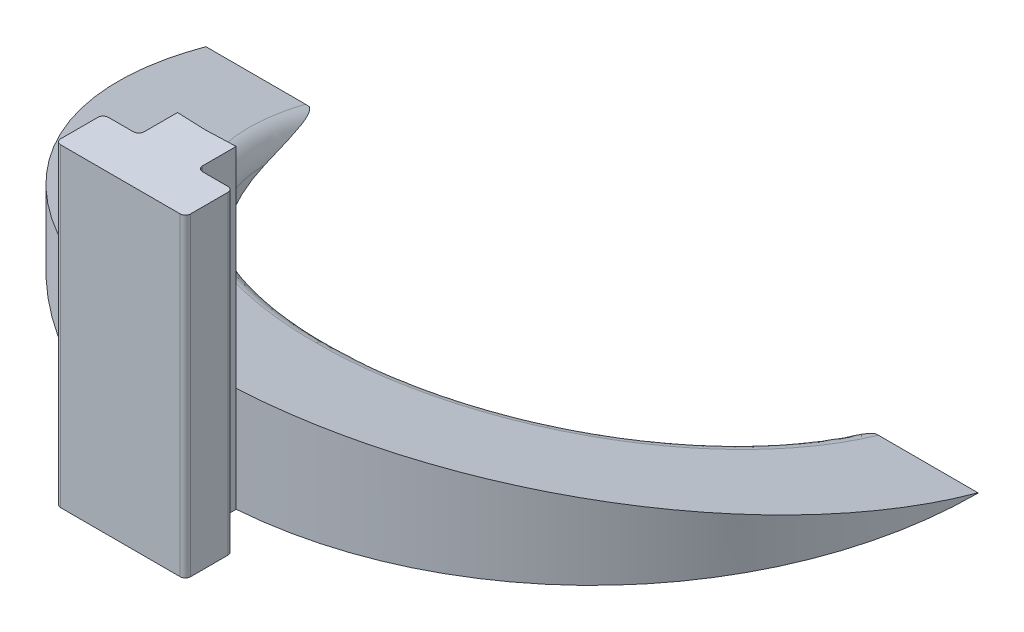
from build123d import *

# Parameters (mm, degrees)
BOSS_EXTRUDE1_DEPTH      = 10
BOSS_EXTRUDE2_DEPTH      = 20
BOSS_EXTRUDE2_DEPTH_BACK = 10
CUT_EXTRUDE1_DEPTH       = 90
FILLET1_R                = 2
FILLET3_R                = 0.5


with BuildPart() as part:
    # Sketch1 → Boss-Extrude1 (new body)
    with BuildSketch(Plane(origin=(0, 0, 0), x_dir=(1, 0, 0), z_dir=(0, 1, 0))):
        with BuildLine():
            Line((36.892843318, -6.916769299), (25.392844844, -6.907371064))
            ThreePointArc((25.392844844, -6.907371064), (17.862146893, -24.595305322), (0.029881046, -31.777555993))
            ThreePointArc((0.029881046, -31.777555993), (-17.799721033, -24.588695191), (-25.323861346, -6.897970432))
            Line((-25.323861346, -6.897970432), (-36.823861346, -6.897970432))
            ThreePointArc((-36.823861346, -6.897970432), (0.025091553, -43.765722197), (36.892843318, -6.916769299))
        make_face()
    extrude(amount=BOSS_EXTRUDE1_DEPTH)

    # Sketch2 → Boss-Extrude2 (add, two sides: drawn at the far end of the back side and taken through both)
    with BuildSketch(Plane(origin=(0, 10, 0), x_dir=(1, 0, 0), z_dir=(0, 1, 0)).offset(-BOSS_EXTRUDE2_DEPTH_BACK)):
        Polygon((2.825670187, -43.65988738), (2.825670187, -47.35988738), (6.225670187, -47.35988738), (6.225670187, -51.90988738), (-6.18199259, -51.90493029), (-6.178356973, -47.354931742), (-2.778358058, -47.357648467), (-2.775401622, -43.657649648), (0.025091553, -43.765722197), align=None)
    extrude(amount=BOSS_EXTRUDE2_DEPTH + BOSS_EXTRUDE2_DEPTH_BACK)

    # Sketch5 → Cut-Extrude1 (cut)
    with BuildSketch(Plane(origin=(36.898477146, 0, 0.030154834), x_dir=(0.0008172376243904341, 0, -0.9999996660612769), z_dir=(0.999999666061277, 0, 0.0008172376243904342))):
        Polygon((-6.7817199, 0), (-6.886616769, 10), (-43.660796033, 10), align=None)
    extrude(amount=-CUT_EXTRUDE1_DEPTH, mode=Mode.SUBTRACT)

    # Fillet1
    fillet1_edges = [part.edges().sort_by_distance(p)[0] for p in [
        (18.020480229, 4.783799393, 24.438665278),
        (-17.957999216, 4.789963113, 24.431993538),
    ]]
    fillet(fillet1_edges, radius=FILLET1_R)

    # Fillet3
    fillet3_edges = [part.edges().sort_by_distance(p)[0] for p in [
        (2.825670187, 15, 47.35988738),
        (-2.778358058, 15, 47.357648467),
        (-6.18199259, 15, 51.90493029),
        (-6.178356973, 15, 47.354931742),
        (6.225670187, 15, 47.35988738),
        (6.225670187, 15, 51.90988738),
    ]]
    fillet(fillet3_edges, radius=FILLET3_R)


solid = part.part
